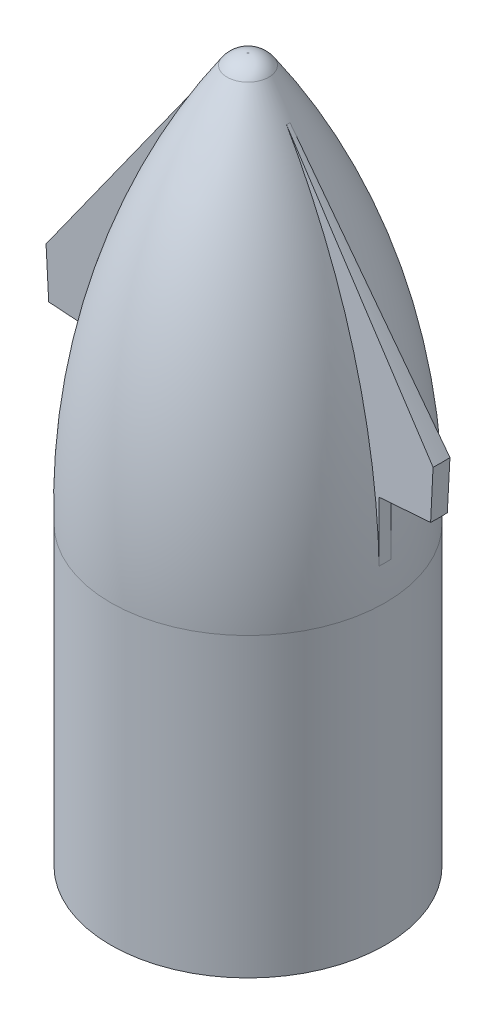
from build123d import *

# Parameters (mm, degrees)
REVOLVE2_ANGLE           = 2.5
REVOLVE2_OTHER_WAY_ANGLE = 2.5


with BuildPart() as part:
    # Sketch1 → Revolve1 (revolve)
    with BuildSketch(Plane.XY, mode=Mode.PRIVATE) as revolve1_sk:
        with BuildLine():
            Line((0, 0), (50.9, 0))
            Line((50.9, 0), (50.9, 110))
            ThreePointArc((50.9, 110), (40.894350566, 187.020094879), (7.734219256, 257.252663728))
            ThreePointArc((7.734219256, 257.252663728), (4.50205931, 260.146833019), (0.291414436, 261.192559341))
            Line((0.291414436, 261.192559341), (0, 261.192559341))
            Line((0, 261.192559341), (0, 258.192559341))
            Line((0, 258.192559341), (0.291414436, 258.192559341))
            ThreePointArc((0.291414436, 258.192559341), (3.098511019, 257.495408459), (5.253284316, 255.565962266))
            ThreePointArc((5.253284316, 255.565962266), (38.021126548, 186.156967057), (47.9, 110.040293721))
            Line((47.9, 110.040293721), (47.9, 3))
            Line((47.9, 3), (0, 3))
            Line((0, 3), (0, 0))
        make_face()
    revolve(revolve1_sk.sketch.rotate(Axis((0, 261.192559341, 0), (0, -1, 0)), 90), axis=Axis((0, 261.192559341, 0), (0, -1, 0)))


with BuildPart() as body_2:
    # Sketch2 → Revolve2 (revolve)
    with BuildSketch(Plane.XY):
        with BuildLine():
            Line((-50.9, 122.859035945), (-50.9, 145))
            Line((-50.9, 145), (-70.9, 147.323164187))
            Line((-70.9, 147.323164187), (-71.846296568, 165.523219819))
            Line((-71.846296568, 165.523219819), (-14.082444903, 247.152488104))
            ThreePointArc((-14.082444903, 247.152488104), (-40.68754222, 187.433632917), (-50.9, 122.859035945))
        make_face()
        with BuildLine():
            ThreePointArc((50.9, 122.859035945), (40.68754222, 187.433632917), (14.082444903, 247.152488104))
            Line((14.082444903, 247.152488104), (71.846296568, 165.523219819))
            Line((71.846296568, 165.523219819), (70.9, 147.323164187))
            Line((70.9, 147.323164187), (50.9, 145))
            Line((50.9, 145), (50.9, 122.859035945))
        make_face()
    revolve(axis=Axis((0, 108.994029955, 0), (0, 1, 0)), revolution_arc=REVOLVE2_ANGLE)

    # Sketch2 → Revolve2 other way (revolve)
    with BuildSketch(Plane.XY):
        with BuildLine():
            Line((-50.9, 122.859035945), (-50.9, 145))
            Line((-50.9, 145), (-70.9, 147.323164187))
            Line((-70.9, 147.323164187), (-71.846296568, 165.523219819))
            Line((-71.846296568, 165.523219819), (-14.082444903, 247.152488104))
            ThreePointArc((-14.082444903, 247.152488104), (-40.68754222, 187.433632917), (-50.9, 122.859035945))
        make_face()
        with BuildLine():
            ThreePointArc((50.9, 122.859035945), (40.68754222, 187.433632917), (14.082444903, 247.152488104))
            Line((14.082444903, 247.152488104), (71.846296568, 165.523219819))
            Line((71.846296568, 165.523219819), (70.9, 147.323164187))
            Line((70.9, 147.323164187), (50.9, 145))
            Line((50.9, 145), (50.9, 122.859035945))
        make_face()
    revolve(axis=Axis((0, 108.994029955, 0), (0, -1, 0)), revolution_arc=REVOLVE2_OTHER_WAY_ANGLE)


solid = Compound([part.part, body_2.part])
